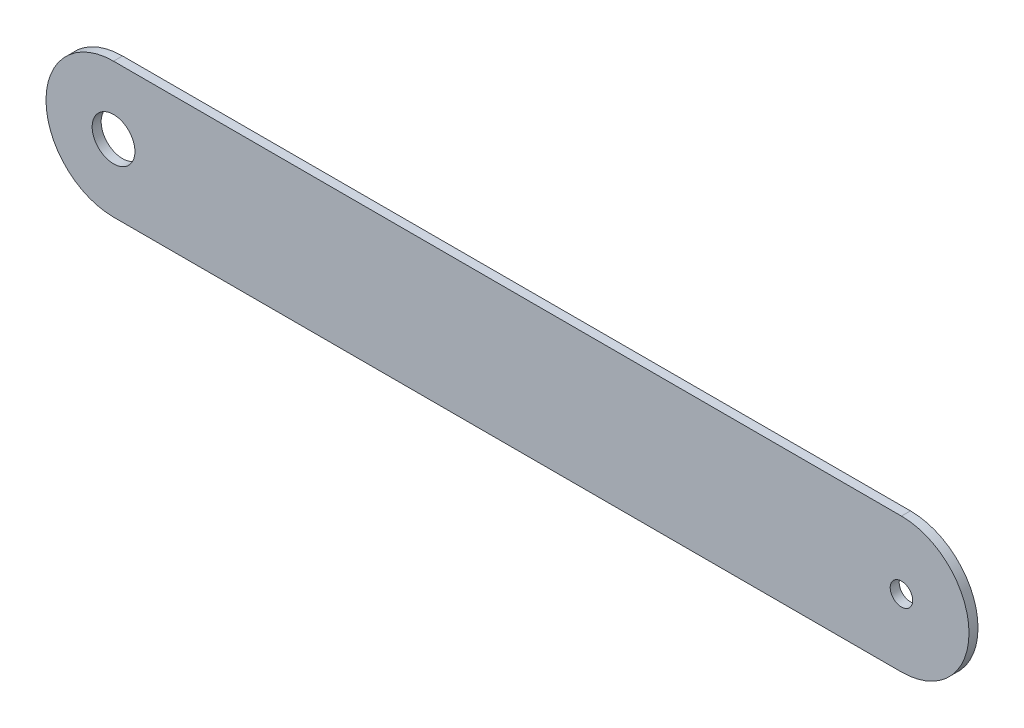
from build123d import *

# Parameters (mm, degrees)
SKETCH_1_R      = 9.5
SKETCH_1_R_2    = 5
EXTRUDE_1_DEPTH = 4


with BuildPart() as part:
    # 草图1 → 凸台-拉伸1 (new body)
    with BuildSketch(Plane.XY):
        with BuildLine():
            Line((348.542857143, -30.145714286), (-1.457142857, -30.145714286))
            ThreePointArc((-1.457142857, -30.145714286), (-31.457142857, -0.145714286), (-1.457142857, 29.854285714))
            Line((-1.457142857, 29.854285714), (348.542857143, 29.854285714))
            ThreePointArc((348.542857143, 29.854285714), (378.542857143, -0.145714286), (348.542857143, -30.145714286))
        make_face()
        with Locations((-1.457142857, -0.145714286)):
            Circle(SKETCH_1_R, mode=Mode.SUBTRACT)
        with Locations((348.542857143, -0.145714286)):
            Circle(SKETCH_1_R_2, mode=Mode.SUBTRACT)
    extrude(amount=EXTRUDE_1_DEPTH)


solid = part.part
